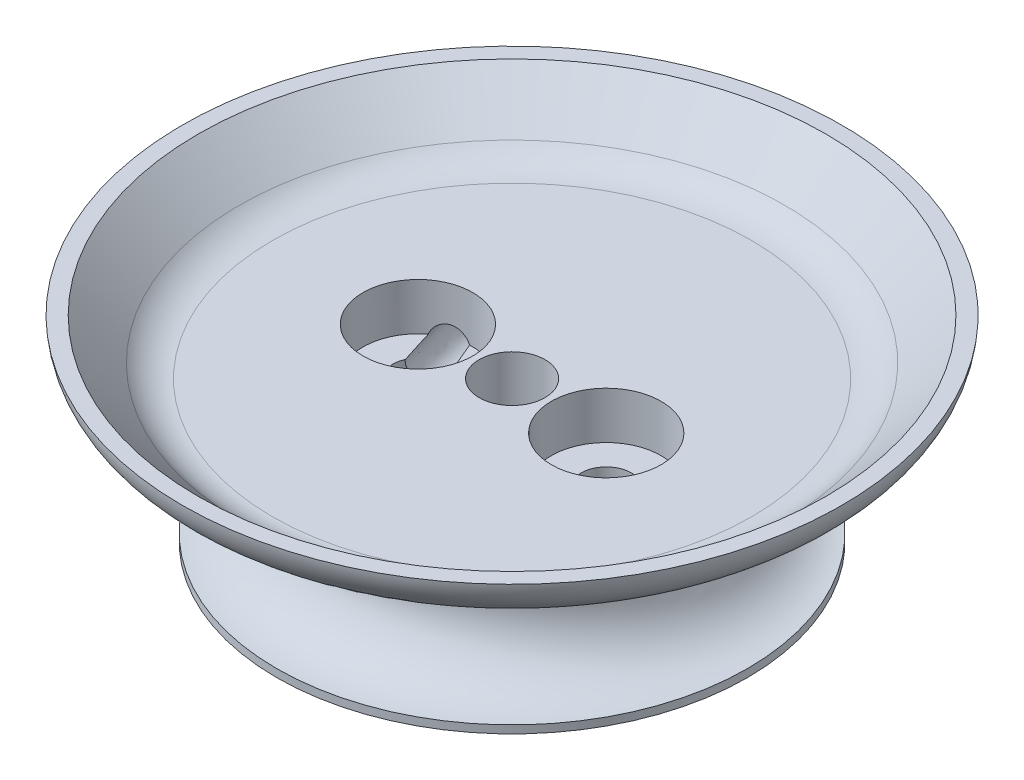
from build123d import *

# Parameters (mm, degrees)
SKETCH_1_R          = 15
EXTRUDE_1_DEPTH     = 9
CUT_EXTRUDE_1_REACH = 25.043
SKETCH_2_R          = 2.1
CUT_EXTRUDE_2_REACH = 25.043
SKETCH_3_R          = 1.6
SKETCH_4_R          = 3.5
CUT_EXTRUDE_3_DEPTH = 3
SKETCH_5_R          = 4
CHAMFER_1_SIZE      = 5
FILLET_2_R          = 1


with BuildPart() as part:
    # 草图1 → 凸台-拉伸1 (new body)
    with BuildSketch(Plane(origin=(0, 0, 0), x_dir=(1, 0, 0), z_dir=(0, 1, 0))):
        with Locations(Location((0, 0, 0), (0, 0, 270))):
            Circle(SKETCH_1_R)
    extrude(amount=EXTRUDE_1_DEPTH)

    # 草图2 → 切除-拉伸1 (cut, up to next)
    with BuildSketch(Plane(origin=(0, 9, 0), x_dir=(1, 0, 0), z_dir=(0, 1, 0)), mode=Mode.PRIVATE) as cut_extrude_1_sk1:
        with Locations(Location((0, 0, 0), (0, 0, 270))):
            Circle(SKETCH_2_R)
    cut_extrude_1_tool1 = extrude(cut_extrude_1_sk1.sketch, amount=-CUT_EXTRUDE_1_REACH, mode=Mode.PRIVATE) & part.part
    add(cut_extrude_1_tool1.solids().sort_by_distance((0, 9, 0))[0], mode=Mode.SUBTRACT)

    # 草图3 → 切除-拉伸2 (cut, up to next)
    with BuildSketch(Plane(origin=(0, 9, 0), x_dir=(1, 0, 0), z_dir=(0, 1, 0)), mode=Mode.PRIVATE) as cut_extrude_2_sk1:
        with Locations(Location((-6, 0, 0), (0, 0, 270))):
            Circle(SKETCH_3_R)
    cut_extrude_2_tool1 = extrude(cut_extrude_2_sk1.sketch, amount=-CUT_EXTRUDE_2_REACH, mode=Mode.PRIVATE) & part.part
    # 草图3 → 切除-拉伸2 (cut, up to next)
    with BuildSketch(Plane(origin=(0, 9, 0), x_dir=(1, 0, 0), z_dir=(0, 1, 0)), mode=Mode.PRIVATE) as cut_extrude_2_sk2:
        with Locations(Location((6, 0, 0), (0, 0, 270))):
            Circle(SKETCH_3_R)
    cut_extrude_2_tool2 = extrude(cut_extrude_2_sk2.sketch, amount=-CUT_EXTRUDE_2_REACH, mode=Mode.PRIVATE) & part.part
    add(cut_extrude_2_tool1.solids().sort_by_distance((-6, 9, 0))[0], mode=Mode.SUBTRACT)
    add(cut_extrude_2_tool2.solids().sort_by_distance((6, 9, 0))[0], mode=Mode.SUBTRACT)

    # 草图4 → 切除-拉伸3 (cut)
    with BuildSketch(Plane(origin=(0, 9, 0), x_dir=(1, 0, 0), z_dir=(0, 1, 0))):
        with Locations(Location((-6, 0, 0), (0, 0, 270))):
            Circle(SKETCH_4_R)
        with Locations(Location((6, 0, 0), (0, 0, 270))):
            Circle(SKETCH_4_R)
    extrude(amount=-CUT_EXTRUDE_3_DEPTH, mode=Mode.SUBTRACT)

    # 草图5 → 切除-旋转1 (revolve, cut)
    with BuildSketch(Plane.XY, mode=Mode.PRIVATE) as cut_revolve_1_sk:
        with Locations((15, 4.5)):
            Circle(SKETCH_5_R)
    revolve(cut_revolve_1_sk.sketch.rotate(Axis((0, 9, 0), (0, -1, 0)), 90), axis=Axis((0, 9, 0), (0, -1, 0)), mode=Mode.SUBTRACT)

    # 草图8 → 旋转1 (revolve)
    with BuildSketch(Plane(origin=(0, 0, 0), x_dir=(0, 0, -1), z_dir=(1, 0, 0)), mode=Mode.PRIVATE) as revolve_1_sk:
        with BuildLine():
            Line((15, 9), (15, 12.5))
            Line((15, 12.5), (21, 12.5))
            Line((21, 12.5), (21, 11))
            Line((21, 11), (11.074743567, 5.269650526))
            ThreePointArc((11.074743567, 5.269650526), (12.4582095, 7.588575894), (15, 8.5))
            Line((15, 8.5), (15, 9))
        make_face()
    revolve(revolve_1_sk.sketch.rotate(Axis((0, 14.925695769, 0), (0, -1, 0)), 180), axis=Axis((0, 14.925695769, 0), (0, -1, 0)))

    # 倒角1
    # the kernel refuses this chamfer: 5 mm, written as the material it takes off along each edge
    with BuildSketch(Plane(origin=(0, 12.5, 0), x_dir=(0, 0, 1), z_dir=(1, 0, 0))) as chamfer_1_piece_1_section:
        Polygon((15, CHAMFER_1_SIZE), (15 + CHAMFER_1_SIZE, 0), (15, 0), align=None)
    chamfer_1_piece_1 = revolve(axis=Axis((0, 12.5, 0), (0, -1, 0)), mode=Mode.PRIVATE)
    chamfer_1_piece_1 = split(chamfer_1_piece_1, bisect_by=Plane(origin=(0, 9, 0), z_dir=(0, 1, 0)), keep=Keep.TOP, mode=Mode.PRIVATE)
    add(chamfer_1_piece_1, mode=Mode.SUBTRACT)

    # 圆角1: read off the stored shape, not the designer's step
    # 圆角1 outline → 圆角1 (revolve, cut)
    with BuildSketch(Plane.XY):
        with BuildLine():
            Line((19.509414739, 10.139410198), (21, 10.139410198))
            Line((21, 10.139410198), (21, 12.5))
            ThreePointArc((21, 12.5), (20.546033561, 11.135748307), (19.509414739, 10.139410198))
        make_face()
    revolve(axis=Axis((0, 0, 0), (0, 1, 0)), mode=Mode.SUBTRACT)

    # Fillet 1 2 outline → Fillet 1 2 (revolve)
    with BuildSketch(Plane.XY):
        with BuildLine():
            Line((17.378679656, 9), (17.378679656, 9.878679656))
            ThreePointArc((17.378679656, 9.878679656), (16.40540961, 9.228361402), (15.257359313, 9))
            Line((15.257359313, 9), (17.378679656, 9))
        make_face()
    revolve(axis=Axis((0, 0, 0), (0, 1, 0)))

    # 圆角2
    fillet_2_edges = [part.edges().sort_by_distance(p)[0] for p in [
        (0, 5.269650526, -11.074743567),
    ]]
    fillet(fillet_2_edges, radius=FILLET_2_R)

    # 切除-放样1: read off the stored shape, not the designer's step
    # 切除-放样1: loft between two sections, ruled curve by curve
    loft_1_from = [
        Edge.make_bspline([(-7.08226986, 6.625453395, 0), (-7.030148744, 6.71564255, 0), (-6.960222336, 6.811326594, 0), (-6.767481895, 6.995615046, 0), (-6.643840469, 7.084318785, 0), (-6.337247234, 7.215130479, 0), (-6.153397528, 7.255952208, 0), (-5.761468115, 7.242597799, 0), (-5.554924915, 7.186512093, 0), (-5.194168295, 6.978027628, 0), (-5.04245146, 6.827071668, 0), (-4.835200327, 6.494154302, 0), (-4.778778635, 6.31447759, 0), (-4.739045515, 5.98352081, 0), (-4.754171349, 5.832104943, 0), (-4.817616618, 5.57309566, 0), (-4.865609023, 5.46473576, 0), (-4.969851256, 5.28435745, 0), (-5.039777664, 5.188673406, 0), (-5.232518105, 5.004384954, 0), (-5.356159531, 4.915681215, 0), (-5.662752766, 4.784869521, 0), (-5.846602472, 4.744047792, 0), (-6.238531885, 4.757402201, 0), (-6.445075085, 4.813487907, 0), (-6.805831705, 5.021972372, 0), (-6.95754854, 5.172928332, 0), (-7.164799673, 5.505845698, 0), (-7.221221365, 5.68552241, 0), (-7.260954485, 6.01647919, 0), (-7.245828651, 6.167895057, 0), (-7.182383382, 6.42690434, 0), (-7.134390977, 6.53526424, 0), (-7.08226986, 6.625453395, 0)], [0, 0, 0, 0, 0.0625, 0.0625, 0.125, 0.125, 0.1875, 0.1875, 0.25, 0.25, 0.3125, 0.3125, 0.375, 0.375, 0.4375, 0.4375, 0.5, 0.5, 0.5625, 0.5625, 0.625, 0.625, 0.6875, 0.6875, 0.75, 0.75, 0.8125, 0.8125, 0.875, 0.875, 0.9375, 0.9375, 1, 1, 1, 1], 3),
    ]
    loft_1_to = [
        Edge.make_bspline([(-11.314005718, 3.776543732, -11), (-11.374293741, 3.886044208, -11), (-11.429176294, 4.017242171, -11), (-11.498850196, 4.329564997, -11), (-11.513230125, 4.511601305, -11), (-11.457326547, 4.907675528, -11), (-11.385164779, 5.121837485, -11), (-11.128234017, 5.516096119, -11), (-10.942457221, 5.693429674, -11), (-10.504455315, 5.934581763, -11), (-10.25526136, 5.996731425, -11), (-9.784714907, 6.003002212, -11), (-9.565158312, 5.949452554, -11), (-9.20058006, 5.784884337, -11), (-9.054449158, 5.675386577, -11), (-8.827795373, 5.44949266, -11), (-8.746282304, 5.332956745, -11), (-8.625706259, 5.113955792, -11), (-8.570823706, 4.982757829, -11), (-8.501149804, 4.670435003, -11), (-8.486769875, 4.488398695, -11), (-8.542673453, 4.092324472, -11), (-8.614835221, 3.878162515, -11), (-8.871765983, 3.483903881, -11), (-9.057542779, 3.306570326, -11), (-9.495544685, 3.065418237, -11), (-9.74473864, 3.003268575, -11), (-10.215285093, 2.996997788, -11), (-10.434841688, 3.050547446, -11), (-10.79941994, 3.215115663, -11), (-10.945550842, 3.324613423, -11), (-11.172204627, 3.55050734, -11), (-11.253717696, 3.667043255, -11), (-11.314005718, 3.776543732, -11)], [0, 0, 0, 0, 0.0625, 0.0625, 0.125, 0.125, 0.1875, 0.1875, 0.25, 0.25, 0.3125, 0.3125, 0.375, 0.375, 0.4375, 0.4375, 0.5, 0.5, 0.5625, 0.5625, 0.625, 0.625, 0.6875, 0.6875, 0.75, 0.75, 0.8125, 0.8125, 0.875, 0.875, 0.9375, 0.9375, 1, 1, 1, 1], 3),
    ]
    loft_1 = Solid(Shell([*[Face.make_surface_from_curves(loft_1_from[k], loft_1_to[k]) for k in range(1)], Face(Wire(loft_1_from)), Face(Wire(loft_1_to))]))
    add(loft_1, mode=Mode.SUBTRACT)


solid = part.part
